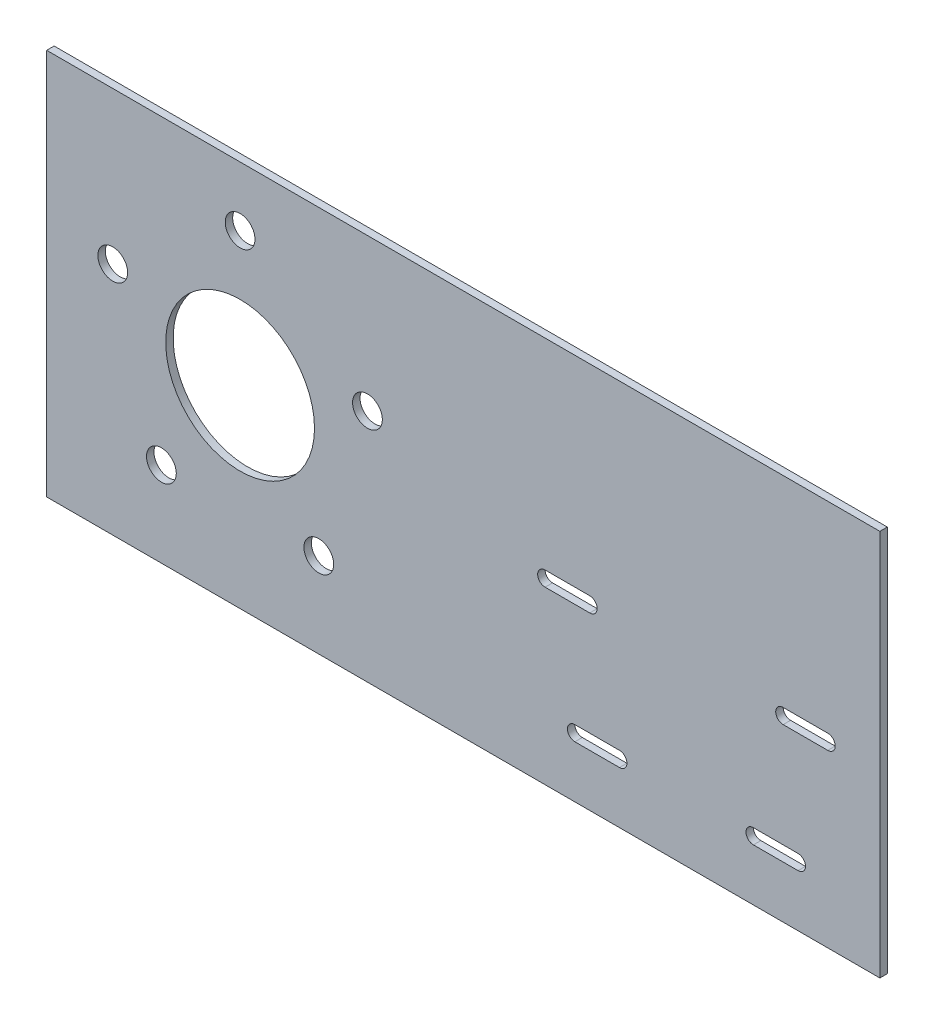
from build123d import *

# Parameters (mm, degrees)
SKETCH2_W             = 355.6
SKETCH2_H             = 165.1
SKETCH2_R             = 31.75
SKETCH2_R_2           = 6.35
BOSS_EXTRUDE1_DEPTH   = 3.175
CUT_EXTRUDE1_DEPTH    = 286.273352462
CIRPATTERN1_OUTLINE_R = 6.35
CIRPATTERN1_DEPTH     = 3.175


# Read off the part's stored shape, not the designer's step: CirPattern1
with BuildPart() as part:
    # Sketch2 → Boss-Extrude1 (new body)
    with BuildSketch(Plane.XY):
        with Locations((95.25, 0)):
            Rectangle(SKETCH2_W, SKETCH2_H)
        Circle(SKETCH2_R, mode=Mode.SUBTRACT)
        with Locations((0, 57.15)):
            Circle(SKETCH2_R_2, mode=Mode.SUBTRACT)
    extrude(amount=BOSS_EXTRUDE1_DEPTH)

    # Sketch3 → Cut-Extrude1 (cut, through all)
    with BuildSketch(Plane.XY.offset(3.175)):
        with BuildLine():
            Line((149.225, -9.525), (130.175, -9.525))
            ThreePointArc((130.175, -9.525), (127, -6.35), (130.175, -3.175))
            Line((130.175, -3.175), (149.225, -3.175))
            ThreePointArc((149.225, -3.175), (152.4, -6.35), (149.225, -9.525))
        make_face()
        with BuildLine():
            Line((250.825, -9.525), (231.775, -9.525))
            ThreePointArc((231.775, -9.525), (228.6, -6.35), (231.775, -3.175))
            Line((231.775, -3.175), (250.825, -3.175))
            ThreePointArc((250.825, -3.175), (254, -6.35), (250.825, -9.525))
        make_face()
        with BuildLine():
            Line((238.125, -60.325), (219.075, -60.325))
            ThreePointArc((219.075, -60.325), (215.9, -57.15), (219.075, -53.975))
            Line((219.075, -53.975), (238.125, -53.975))
            ThreePointArc((238.125, -53.975), (241.3, -57.15), (238.125, -60.325))
        make_face()
        with BuildLine():
            Line((142.875, -53.975), (161.925, -53.975))
            ThreePointArc((161.925, -53.975), (165.1, -57.15), (161.925, -60.325))
            Line((161.925, -60.325), (142.875, -60.325))
            ThreePointArc((142.875, -60.325), (139.7, -57.15), (142.875, -53.975))
        make_face()
    extrude(amount=-CUT_EXTRUDE1_DEPTH, mode=Mode.SUBTRACT)

    # CirPattern1 outline → CirPattern1 (cut)
    with BuildSketch(Plane.XY):
        with Locations((-54.352879906, 17.660321229)):
            Circle(CIRPATTERN1_OUTLINE_R)
        with Locations((-33.591927169, -46.235321229)):
            Circle(CIRPATTERN1_OUTLINE_R)
        with Locations((33.591927169, -46.235321229)):
            Circle(CIRPATTERN1_OUTLINE_R)
        with Locations((54.352879906, 17.660321229)):
            Circle(CIRPATTERN1_OUTLINE_R)
    extrude(amount=CIRPATTERN1_DEPTH, mode=Mode.SUBTRACT)


solid = part.part
